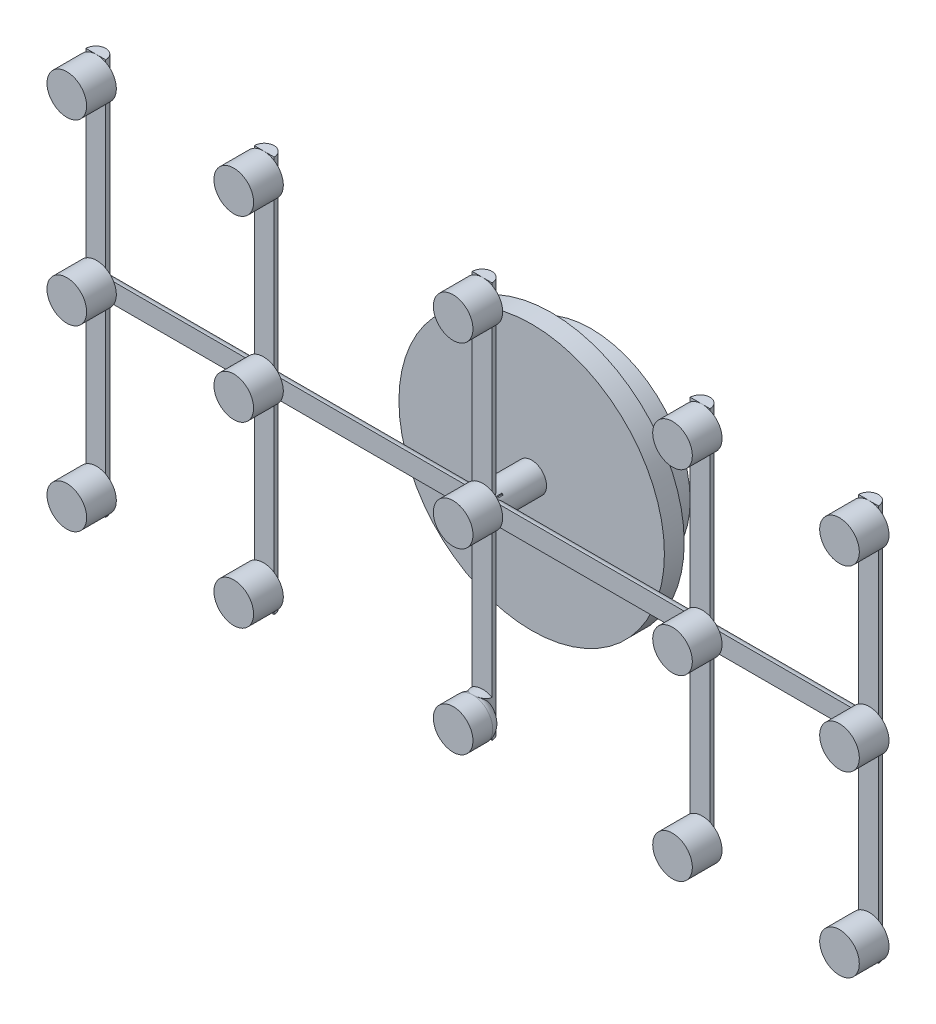
from build123d import *

# Parameters (mm, degrees)
SKIZZE2_R                       = 50
AUFSATZ_LINEAR_AUSTRAGEN1_DEPTH = 20
SKIZZE3_R                       = 67
AUFSATZ_LINEAR_AUSTRAGEN2_DEPTH = 10
SKIZZE5_R                       = 7.5
AUFSATZ_LINEAR_AUSTRAGEN3_DEPTH = 20
SKIZZE6_W                       = 400
SKIZZE6_H                       = 10
AUFSATZ_LINEAR_AUSTRAGEN4_DEPTH = 5
SKIZZE7_W                       = 10
SKIZZE7_H                       = 200
AUFSATZ_LINEAR_AUSTRAGEN5_DEPTH = 5
SKIZZE8_W                       = 10
SKIZZE8_H                       = 200
AUFSATZ_LINEAR_AUSTRAGEN6_DEPTH = 5
SKIZZE9_R                       = 10
AUFSATZ_LINEAR_AUSTRAGEN7_DEPTH = 15
VERRUNDUNG5_R                   = 5
VERRUNDUNG6_R                   = 5


with BuildPart() as part:
    # Skizze2 → Aufsatz-Linear austragen1 (new body)
    with BuildSketch(Plane.XY):
        Circle(SKIZZE2_R)
    extrude(amount=AUFSATZ_LINEAR_AUSTRAGEN1_DEPTH)

    # Skizze3 → Aufsatz-Linear austragen2 (add)
    with BuildSketch(Plane.XY.offset(20)):
        Circle(SKIZZE3_R)
    extrude(amount=AUFSATZ_LINEAR_AUSTRAGEN2_DEPTH)

    # Skizze5 → Aufsatz-Linear austragen3 (add)
    with BuildSketch(Plane.XY.offset(30)):
        Circle(SKIZZE5_R)
    extrude(amount=AUFSATZ_LINEAR_AUSTRAGEN3_DEPTH)

    # Skizze6 → Aufsatz-Linear austragen4 (add)
    with BuildSketch(Plane.XY.offset(50)):
        Rectangle(SKIZZE6_W, SKIZZE6_H)
    extrude(amount=AUFSATZ_LINEAR_AUSTRAGEN4_DEPTH)

    # Skizze7 → Aufsatz-Linear austragen5 (add)
    with BuildSketch(Plane.XY.offset(50)):
        Rectangle(SKIZZE7_W, SKIZZE7_H)
    extrude(amount=AUFSATZ_LINEAR_AUSTRAGEN5_DEPTH)

    # Skizze8 → Aufsatz-Linear austragen6 (add)
    with BuildSketch(Plane.XY.offset(50)):
        with Locations((-110, 0)):
            Rectangle(SKIZZE8_W, SKIZZE8_H)
        with Locations((110, 0)):
            Rectangle(SKIZZE8_W, SKIZZE8_H)
        with Locations((-195, 0)):
            Rectangle(SKIZZE8_W, SKIZZE8_H)
        with Locations((195, 0)):
            Rectangle(SKIZZE8_W, SKIZZE8_H)
    extrude(amount=AUFSATZ_LINEAR_AUSTRAGEN6_DEPTH)

    # Skizze9 → Aufsatz-Linear austragen7 (add)
    with BuildSketch(Plane.XY.offset(55)):
        with Locations(Location((-194.635853284, 90, 0), (0, 0, 237.560098087))):
            Circle(SKIZZE9_R)
        with Locations(Location((-194.635853284, 0, 0), (0, 0, 237.560098087))):
            Circle(SKIZZE9_R)
        with Locations(Location((-110.364146716, 0, 0), (0, 0, 180))):
            Circle(SKIZZE9_R)
        with Locations(Location((-110.364146716, 90, 0), (0, 0, 180))):
            Circle(SKIZZE9_R)
        with Locations(Location((0.364146716, 0, 0), (0, 0, 150))):
            Circle(SKIZZE9_R)
        with Locations(Location((0.364146716, 90, 0), (0, 0, 237.560098087))):
            Circle(SKIZZE9_R)
        with Locations(Location((111.092440149, 0, 0), (0, 0, 150))):
            Circle(SKIZZE9_R)
        with Locations(Location((111.092440149, 90, 0), (0, 0, 127.534860373))):
            Circle(SKIZZE9_R)
        with Locations(Location((195.364146716, 0, 0), (0, 0, 180))):
            Circle(SKIZZE9_R)
        with Locations(Location((195.364146716, 90, 0), (0, 0, 180))):
            Circle(SKIZZE9_R)
        with Locations(Location((195.364146716, -90, 0), (0, 0, 122.439901913))):
            Circle(SKIZZE9_R)
        with Locations(Location((111.092440149, -90, 0), (0, 0, 180))):
            Circle(SKIZZE9_R)
        with Locations(Location((0.364146716, -90, 0), (0, 0, 180))):
            Circle(SKIZZE9_R)
        with Locations(Location((-110.364146716, -90, 0), (0, 0, 117.618705292))):
            Circle(SKIZZE9_R)
        with Locations(Location((-194.635853284, -90, 0), (0, 0, 180))):
            Circle(SKIZZE9_R)
    extrude(amount=AUFSATZ_LINEAR_AUSTRAGEN7_DEPTH)

    # Verrundung5
    # the kernel refuses this fillet: 5 mm, written as the material it takes off along each edge
    with BuildSketch(Plane(origin=(-190, -112.5, 50), x_dir=(-1, 0, 0), z_dir=(0, 1, 0))) as verrundung5_piece_1_section:
        with BuildLine():
            CenterArc((VERRUNDUNG5_R, VERRUNDUNG5_R), VERRUNDUNG5_R, 180, 90)
            Line((0, VERRUNDUNG5_R), (0, 0))
            Line((0, 0), (VERRUNDUNG5_R, 0))
        make_face()
    verrundung5_piece_1 = extrude(amount=120, mode=Mode.PRIVATE)
    verrundung5_piece_1 = verrundung5_piece_1 - Plane(origin=(-190, 0, 55), x_dir=(0, 0, -1), z_dir=(1, 0, 0)) * Cylinder(5, 260, mode=Mode.PRIVATE)
    add(verrundung5_piece_1, mode=Mode.SUBTRACT)
    with BuildSketch(Plane(origin=(-200, -112.5, 50), x_dir=(1, 0, 0), z_dir=(0, 1, 0)), Plane(origin=(200, 112.5, 50), x_dir=(-1, 0, 0), z_dir=(0, -1, 0))) as verrundung5_piece_2:
        with BuildLine():
            CenterArc((VERRUNDUNG5_R, -VERRUNDUNG5_R), VERRUNDUNG5_R, 90, 90)
            Line((0, -VERRUNDUNG5_R), (0, 0))
            Line((0, 0), (VERRUNDUNG5_R, 0))
        make_face()
    extrude(amount=225, mode=Mode.SUBTRACT)
    with BuildSketch(Plane(origin=(190, -7.5, 50), x_dir=(1, 0, 0), z_dir=(0, 1, 0))) as verrundung5_piece_3_section:
        with BuildLine():
            CenterArc((VERRUNDUNG5_R, -VERRUNDUNG5_R), VERRUNDUNG5_R, 90, 90)
            Line((0, -VERRUNDUNG5_R), (0, 0))
            Line((0, 0), (VERRUNDUNG5_R, 0))
        make_face()
    verrundung5_piece_3 = extrude(amount=120, mode=Mode.PRIVATE)
    verrundung5_piece_3 = verrundung5_piece_3 - Plane(origin=(190, 0, 55), x_dir=(0, 0, -1), z_dir=(-1, 0, 0)) * Cylinder(5, 260, mode=Mode.PRIVATE)
    add(verrundung5_piece_3, mode=Mode.SUBTRACT)
    with BuildSketch(Plane(origin=(190, -112.5, 50), x_dir=(1, 0, 0), z_dir=(0, 1, 0))) as verrundung5_piece_4_section:
        with BuildLine():
            CenterArc((VERRUNDUNG5_R, -VERRUNDUNG5_R), VERRUNDUNG5_R, 90, 90)
            Line((0, -VERRUNDUNG5_R), (0, 0))
            Line((0, 0), (VERRUNDUNG5_R, 0))
        make_face()
    verrundung5_piece_4 = extrude(amount=120, mode=Mode.PRIVATE)
    verrundung5_piece_4 = verrundung5_piece_4 - Plane(origin=(190, 0, 55), x_dir=(0, 0, -1), z_dir=(1, 0, 0)) * Cylinder(5, 261, mode=Mode.PRIVATE)
    add(verrundung5_piece_4, mode=Mode.SUBTRACT)
    with BuildSketch(Plane(origin=(202.5, -5, 50), x_dir=(0, 1, 0), z_dir=(-1, 0, 0))) as verrundung5_piece_5_section:
        with BuildLine():
            CenterArc((VERRUNDUNG5_R, -VERRUNDUNG5_R), VERRUNDUNG5_R, 90, 90)
            Line((0, -VERRUNDUNG5_R), (0, 0))
            Line((0, 0), (VERRUNDUNG5_R, 0))
        make_face()
    verrundung5_piece_5 = extrude(amount=100, mode=Mode.PRIVATE)
    verrundung5_piece_5 = verrundung5_piece_5 - Plane(origin=(195, -5, 55), x_dir=(0, 0, -1), z_dir=(0, -1, 0)) * Cylinder(5, 220, mode=Mode.PRIVATE)
    verrundung5_piece_5 = verrundung5_piece_5 - Plane(origin=(110, -5, 55), x_dir=(0, 0, -1), z_dir=(0, 1, 0)) * Cylinder(5, 220, mode=Mode.PRIVATE)
    add(verrundung5_piece_5, mode=Mode.SUBTRACT)
    with BuildSketch(Plane(origin=(102.5, 5, 50), x_dir=(0, -1, 0), z_dir=(1, 0, 0))) as verrundung5_piece_6_section:
        with BuildLine():
            CenterArc((VERRUNDUNG5_R, -VERRUNDUNG5_R), VERRUNDUNG5_R, 90, 90)
            Line((0, -VERRUNDUNG5_R), (0, 0))
            Line((0, 0), (VERRUNDUNG5_R, 0))
        make_face()
    verrundung5_piece_6 = extrude(amount=100, mode=Mode.PRIVATE)
    verrundung5_piece_6 = verrundung5_piece_6 - Plane(origin=(110, 5, 55), x_dir=(0, 0, -1), z_dir=(0, 1, 0)) * Cylinder(5, 220, mode=Mode.PRIVATE)
    verrundung5_piece_6 = verrundung5_piece_6 - Plane(origin=(195, 5, 55), x_dir=(0, 0, -1), z_dir=(0, -1, 0)) * Cylinder(5, 220, mode=Mode.PRIVATE)
    add(verrundung5_piece_6, mode=Mode.SUBTRACT)
    with BuildSketch(Plane(origin=(115, 112.5, 50), x_dir=(-1, 0, 0), z_dir=(0, -1, 0))) as verrundung5_piece_7_section:
        with BuildLine():
            CenterArc((VERRUNDUNG5_R, -VERRUNDUNG5_R), VERRUNDUNG5_R, 90, 90)
            Line((0, -VERRUNDUNG5_R), (0, 0))
            Line((0, 0), (VERRUNDUNG5_R, 0))
        make_face()
    verrundung5_piece_7 = extrude(amount=120, mode=Mode.PRIVATE)
    verrundung5_piece_7 = verrundung5_piece_7 - Plane(origin=(115, 0, 55), x_dir=(0, 0, -1), z_dir=(-1, 0, 0)) * Cylinder(5, 260, mode=Mode.PRIVATE)
    add(verrundung5_piece_7, mode=Mode.SUBTRACT)
    with BuildSketch(Plane(origin=(105, -7.5, 50), x_dir=(1, 0, 0), z_dir=(0, 1, 0))) as verrundung5_piece_8_section:
        with BuildLine():
            CenterArc((VERRUNDUNG5_R, -VERRUNDUNG5_R), VERRUNDUNG5_R, 90, 90)
            Line((0, -VERRUNDUNG5_R), (0, 0))
            Line((0, 0), (VERRUNDUNG5_R, 0))
        make_face()
    verrundung5_piece_8 = extrude(amount=120, mode=Mode.PRIVATE)
    verrundung5_piece_8 = verrundung5_piece_8 - Plane(origin=(105, 0, 55), x_dir=(0, 0, -1), z_dir=(-1, 0, 0)) * Cylinder(5, 260, mode=Mode.PRIVATE)
    add(verrundung5_piece_8, mode=Mode.SUBTRACT)
    with BuildSketch(Plane(origin=(105, -112.5, 50), x_dir=(1, 0, 0), z_dir=(0, 1, 0))) as verrundung5_piece_9_section:
        with BuildLine():
            CenterArc((VERRUNDUNG5_R, -VERRUNDUNG5_R), VERRUNDUNG5_R, 90, 90)
            Line((0, -VERRUNDUNG5_R), (0, 0))
            Line((0, 0), (VERRUNDUNG5_R, 0))
        make_face()
    verrundung5_piece_9 = extrude(amount=120, mode=Mode.PRIVATE)
    verrundung5_piece_9 = verrundung5_piece_9 - Plane(origin=(105, 0, 55), x_dir=(0, 0, -1), z_dir=(1, 0, 0)) * Cylinder(5, 261, mode=Mode.PRIVATE)
    add(verrundung5_piece_9, mode=Mode.SUBTRACT)
    with BuildSketch(Plane(origin=(115, 7.5, 50), x_dir=(-1, 0, 0), z_dir=(0, -1, 0))) as verrundung5_piece_10_section:
        with BuildLine():
            CenterArc((VERRUNDUNG5_R, -VERRUNDUNG5_R), VERRUNDUNG5_R, 90, 90)
            Line((0, -VERRUNDUNG5_R), (0, 0))
            Line((0, 0), (VERRUNDUNG5_R, 0))
        make_face()
    verrundung5_piece_10 = extrude(amount=120, mode=Mode.PRIVATE)
    verrundung5_piece_10 = verrundung5_piece_10 - Plane(origin=(115, 0, 55), x_dir=(0, 0, -1), z_dir=(1, 0, 0)) * Cylinder(5, 261, mode=Mode.PRIVATE)
    add(verrundung5_piece_10, mode=Mode.SUBTRACT)
    with BuildSketch(Plane(origin=(117.5, -5, 50), x_dir=(0, 1, 0), z_dir=(-1, 0, 0))) as verrundung5_piece_11_section:
        with BuildLine():
            CenterArc((VERRUNDUNG5_R, -VERRUNDUNG5_R), VERRUNDUNG5_R, 90, 90)
            Line((0, -VERRUNDUNG5_R), (0, 0))
            Line((0, 0), (VERRUNDUNG5_R, 0))
        make_face()
    verrundung5_piece_11 = extrude(amount=124.409830056, mode=Mode.PRIVATE)
    verrundung5_piece_11 = verrundung5_piece_11 - Plane(origin=(0, 0, 50), x_dir=(1, 0, 0), z_dir=(0, 0, -1)) * Cylinder(7.5, 269, mode=Mode.PRIVATE)
    verrundung5_piece_11 = verrundung5_piece_11 - Plane(origin=(110, -5, 55), x_dir=(0, 0, -1), z_dir=(0, -1, 0)) * Cylinder(5, 269, mode=Mode.PRIVATE)
    add(verrundung5_piece_11, mode=Mode.SUBTRACT)
    with BuildSketch(Plane(origin=(-6.909830056, 5, 50), x_dir=(0, -1, 0), z_dir=(1, 0, 0))) as verrundung5_piece_12_section:
        with BuildLine():
            CenterArc((VERRUNDUNG5_R, -VERRUNDUNG5_R), VERRUNDUNG5_R, 90, 90)
            Line((0, -VERRUNDUNG5_R), (0, 0))
            Line((0, 0), (VERRUNDUNG5_R, 0))
        make_face()
    verrundung5_piece_12 = extrude(amount=124.409830056, mode=Mode.PRIVATE)
    verrundung5_piece_12 = verrundung5_piece_12 - Plane(origin=(0, 0, 50), x_dir=(1, 0, 0), z_dir=(0, 0, -1)) * Cylinder(7.5, 269, mode=Mode.PRIVATE)
    verrundung5_piece_12 = verrundung5_piece_12 - Plane(origin=(110, 5, 55), x_dir=(0, 0, -1), z_dir=(0, -1, 0)) * Cylinder(5, 269, mode=Mode.PRIVATE)
    add(verrundung5_piece_12, mode=Mode.SUBTRACT)
    with BuildSketch(Plane(origin=(-5, 112.5, 50), x_dir=(1, 0, 0), z_dir=(0, -1, 0))) as verrundung5_piece_13_section:
        with BuildLine():
            CenterArc((VERRUNDUNG5_R, VERRUNDUNG5_R), VERRUNDUNG5_R, 180, 90)
            Line((0, VERRUNDUNG5_R), (0, 0))
            Line((0, 0), (VERRUNDUNG5_R, 0))
        make_face()
    verrundung5_piece_13 = extrude(amount=119.409830056, mode=Mode.PRIVATE)
    verrundung5_piece_13 = verrundung5_piece_13 - Plane(origin=(0, 0, 50), x_dir=(1, 0, 0), z_dir=(0, 0, -1)) * Cylinder(7.5, 259, mode=Mode.PRIVATE)
    add(verrundung5_piece_13, mode=Mode.SUBTRACT)
    with BuildSketch(Plane(origin=(5, -6.909830056, 50), x_dir=(-1, 0, 0), z_dir=(0, 1, 0))) as verrundung5_piece_14_section:
        with BuildLine():
            CenterArc((VERRUNDUNG5_R, VERRUNDUNG5_R), VERRUNDUNG5_R, 180, 90)
            Line((0, VERRUNDUNG5_R), (0, 0))
            Line((0, 0), (VERRUNDUNG5_R, 0))
        make_face()
    verrundung5_piece_14 = extrude(amount=119.409830056, mode=Mode.PRIVATE)
    verrundung5_piece_14 = verrundung5_piece_14 - Plane(origin=(0, 0, 50), x_dir=(1, 0, 0), z_dir=(0, 0, -1)) * Cylinder(7.5, 259, mode=Mode.PRIVATE)
    add(verrundung5_piece_14, mode=Mode.SUBTRACT)
    with BuildSketch(Plane(origin=(-5, 6.909830056, 50), x_dir=(1, 0, 0), z_dir=(0, -1, 0))) as verrundung5_piece_15_section:
        with BuildLine():
            CenterArc((VERRUNDUNG5_R, VERRUNDUNG5_R), VERRUNDUNG5_R, 180, 90)
            Line((0, VERRUNDUNG5_R), (0, 0))
            Line((0, 0), (VERRUNDUNG5_R, 0))
        make_face()
    verrundung5_piece_15 = extrude(amount=119.409830056, mode=Mode.PRIVATE)
    verrundung5_piece_15 = verrundung5_piece_15 - Plane(origin=(0, 0, 50), x_dir=(1, 0, 0), z_dir=(0, 0, -1)) * Cylinder(7.5, 259, mode=Mode.PRIVATE)
    add(verrundung5_piece_15, mode=Mode.SUBTRACT)
    with BuildSketch(Plane(origin=(5, -112.5, 50), x_dir=(-1, 0, 0), z_dir=(0, 1, 0))) as verrundung5_piece_16_section:
        with BuildLine():
            CenterArc((VERRUNDUNG5_R, VERRUNDUNG5_R), VERRUNDUNG5_R, 180, 90)
            Line((0, VERRUNDUNG5_R), (0, 0))
            Line((0, 0), (VERRUNDUNG5_R, 0))
        make_face()
    verrundung5_piece_16 = extrude(amount=119.409830056, mode=Mode.PRIVATE)
    verrundung5_piece_16 = verrundung5_piece_16 - Plane(origin=(0, 0, 50), x_dir=(1, 0, 0), z_dir=(0, 0, -1)) * Cylinder(7.5, 259, mode=Mode.PRIVATE)
    add(verrundung5_piece_16, mode=Mode.SUBTRACT)
    with BuildSketch(Plane(origin=(-202.5, 5, 50), x_dir=(0, -1, 0), z_dir=(1, 0, 0))) as verrundung5_piece_17_section:
        with BuildLine():
            CenterArc((VERRUNDUNG5_R, -VERRUNDUNG5_R), VERRUNDUNG5_R, 90, 90)
            Line((0, -VERRUNDUNG5_R), (0, 0))
            Line((0, 0), (VERRUNDUNG5_R, 0))
        make_face()
    verrundung5_piece_17 = extrude(amount=100, mode=Mode.PRIVATE)
    verrundung5_piece_17 = verrundung5_piece_17 - Plane(origin=(-195, 5, 55), x_dir=(0, 0, -1), z_dir=(0, -1, 0)) * Cylinder(5, 220, mode=Mode.PRIVATE)
    verrundung5_piece_17 = verrundung5_piece_17 - Plane(origin=(-110, 5, 55), x_dir=(0, 0, -1), z_dir=(0, 1, 0)) * Cylinder(5, 220, mode=Mode.PRIVATE)
    add(verrundung5_piece_17, mode=Mode.SUBTRACT)
    with BuildSketch(Plane(origin=(-102.5, -5, 50), x_dir=(0, 1, 0), z_dir=(-1, 0, 0))) as verrundung5_piece_18_section:
        with BuildLine():
            CenterArc((VERRUNDUNG5_R, -VERRUNDUNG5_R), VERRUNDUNG5_R, 90, 90)
            Line((0, -VERRUNDUNG5_R), (0, 0))
            Line((0, 0), (VERRUNDUNG5_R, 0))
        make_face()
    verrundung5_piece_18 = extrude(amount=100, mode=Mode.PRIVATE)
    verrundung5_piece_18 = verrundung5_piece_18 - Plane(origin=(-110, -5, 55), x_dir=(0, 0, -1), z_dir=(0, 1, 0)) * Cylinder(5, 220, mode=Mode.PRIVATE)
    verrundung5_piece_18 = verrundung5_piece_18 - Plane(origin=(-195, -5, 55), x_dir=(0, 0, -1), z_dir=(0, -1, 0)) * Cylinder(5, 220, mode=Mode.PRIVATE)
    add(verrundung5_piece_18, mode=Mode.SUBTRACT)
    with BuildSketch(Plane(origin=(-117.5, 5, 50), x_dir=(0, -1, 0), z_dir=(1, 0, 0))) as verrundung5_piece_19_section:
        with BuildLine():
            CenterArc((VERRUNDUNG5_R, -VERRUNDUNG5_R), VERRUNDUNG5_R, 90, 90)
            Line((0, -VERRUNDUNG5_R), (0, 0))
            Line((0, 0), (VERRUNDUNG5_R, 0))
        make_face()
    verrundung5_piece_19 = extrude(amount=124.409830056, mode=Mode.PRIVATE)
    verrundung5_piece_19 = verrundung5_piece_19 - Plane(origin=(0, 0, 50), x_dir=(1, 0, 0), z_dir=(0, 0, -1)) * Cylinder(7.5, 269, mode=Mode.PRIVATE)
    verrundung5_piece_19 = verrundung5_piece_19 - Plane(origin=(-110, 5, 55), x_dir=(0, 0, -1), z_dir=(0, -1, 0)) * Cylinder(5, 269, mode=Mode.PRIVATE)
    add(verrundung5_piece_19, mode=Mode.SUBTRACT)
    with BuildSketch(Plane(origin=(6.909830056, -5, 50), x_dir=(0, 1, 0), z_dir=(-1, 0, 0))) as verrundung5_piece_20_section:
        with BuildLine():
            CenterArc((VERRUNDUNG5_R, -VERRUNDUNG5_R), VERRUNDUNG5_R, 90, 90)
            Line((0, -VERRUNDUNG5_R), (0, 0))
            Line((0, 0), (VERRUNDUNG5_R, 0))
        make_face()
    verrundung5_piece_20 = extrude(amount=124.409830056, mode=Mode.PRIVATE)
    verrundung5_piece_20 = verrundung5_piece_20 - Plane(origin=(0, 0, 50), x_dir=(1, 0, 0), z_dir=(0, 0, -1)) * Cylinder(7.5, 269, mode=Mode.PRIVATE)
    verrundung5_piece_20 = verrundung5_piece_20 - Plane(origin=(-110, -5, 55), x_dir=(0, 0, -1), z_dir=(0, -1, 0)) * Cylinder(5, 269, mode=Mode.PRIVATE)
    add(verrundung5_piece_20, mode=Mode.SUBTRACT)
    with BuildSketch(Plane(origin=(-105, -7.5, 50), x_dir=(-1, 0, 0), z_dir=(0, 1, 0))) as verrundung5_piece_21_section:
        with BuildLine():
            CenterArc((VERRUNDUNG5_R, VERRUNDUNG5_R), VERRUNDUNG5_R, 180, 90)
            Line((0, VERRUNDUNG5_R), (0, 0))
            Line((0, 0), (VERRUNDUNG5_R, 0))
        make_face()
    verrundung5_piece_21 = extrude(amount=120, mode=Mode.PRIVATE)
    verrundung5_piece_21 = verrundung5_piece_21 - Plane(origin=(-105, 0, 55), x_dir=(0, 0, -1), z_dir=(-1, 0, 0)) * Cylinder(5, 260, mode=Mode.PRIVATE)
    add(verrundung5_piece_21, mode=Mode.SUBTRACT)
    with BuildSketch(Plane(origin=(-115, 112.5, 50), x_dir=(1, 0, 0), z_dir=(0, -1, 0))) as verrundung5_piece_22_section:
        with BuildLine():
            CenterArc((VERRUNDUNG5_R, VERRUNDUNG5_R), VERRUNDUNG5_R, 180, 90)
            Line((0, VERRUNDUNG5_R), (0, 0))
            Line((0, 0), (VERRUNDUNG5_R, 0))
        make_face()
    verrundung5_piece_22 = extrude(amount=120, mode=Mode.PRIVATE)
    verrundung5_piece_22 = verrundung5_piece_22 - Plane(origin=(-115, 0, 55), x_dir=(0, 0, -1), z_dir=(-1, 0, 0)) * Cylinder(5, 260, mode=Mode.PRIVATE)
    add(verrundung5_piece_22, mode=Mode.SUBTRACT)
    with BuildSketch(Plane(origin=(-115, 7.5, 50), x_dir=(1, 0, 0), z_dir=(0, -1, 0))) as verrundung5_piece_23_section:
        with BuildLine():
            CenterArc((VERRUNDUNG5_R, VERRUNDUNG5_R), VERRUNDUNG5_R, 180, 90)
            Line((0, VERRUNDUNG5_R), (0, 0))
            Line((0, 0), (VERRUNDUNG5_R, 0))
        make_face()
    verrundung5_piece_23 = extrude(amount=120, mode=Mode.PRIVATE)
    verrundung5_piece_23 = verrundung5_piece_23 - Plane(origin=(-115, 0, 55), x_dir=(0, 0, -1), z_dir=(1, 0, 0)) * Cylinder(5, 260, mode=Mode.PRIVATE)
    add(verrundung5_piece_23, mode=Mode.SUBTRACT)
    with BuildSketch(Plane(origin=(-105, -112.5, 50), x_dir=(-1, 0, 0), z_dir=(0, 1, 0))) as verrundung5_piece_24_section:
        with BuildLine():
            CenterArc((VERRUNDUNG5_R, VERRUNDUNG5_R), VERRUNDUNG5_R, 180, 90)
            Line((0, VERRUNDUNG5_R), (0, 0))
            Line((0, 0), (VERRUNDUNG5_R, 0))
        make_face()
    verrundung5_piece_24 = extrude(amount=120, mode=Mode.PRIVATE)
    verrundung5_piece_24 = verrundung5_piece_24 - Plane(origin=(-105, 0, 55), x_dir=(0, 0, -1), z_dir=(1, 0, 0)) * Cylinder(5, 260, mode=Mode.PRIVATE)
    add(verrundung5_piece_24, mode=Mode.SUBTRACT)
    with BuildSketch(Plane(origin=(-190, -7.5, 50), x_dir=(-1, 0, 0), z_dir=(0, 1, 0))) as verrundung5_piece_25_section:
        with BuildLine():
            CenterArc((VERRUNDUNG5_R, VERRUNDUNG5_R), VERRUNDUNG5_R, 180, 90)
            Line((0, VERRUNDUNG5_R), (0, 0))
            Line((0, 0), (VERRUNDUNG5_R, 0))
        make_face()
    verrundung5_piece_25 = extrude(amount=120, mode=Mode.PRIVATE)
    verrundung5_piece_25 = verrundung5_piece_25 - Plane(origin=(-190, 0, 55), x_dir=(0, 0, -1), z_dir=(-1, 0, 0)) * Cylinder(5, 260, mode=Mode.PRIVATE)
    add(verrundung5_piece_25, mode=Mode.SUBTRACT)

    # Verrundung6
    # the kernel refuses this fillet: 5 mm, written as the material it takes off along each edge
    with BuildSketch(Plane(origin=(0.364146716, -90, 55), x_dir=(-0.6953651355943523, -0.7186566135504828, 0), z_dir=(-0.7186566135504828, 0.6953651355943523, 0))) as verrundung6_piece_1_section:
        with BuildLine():
            CenterArc((10 - VERRUNDUNG6_R, VERRUNDUNG6_R), VERRUNDUNG6_R, 270, 90)
            Line((10, VERRUNDUNG6_R), (10, 0))
            Line((10, 0), (10 - VERRUNDUNG6_R, 0))
        make_face()
    verrundung6_piece_1 = revolve(axis=Axis((0.364146716, -90, 55), (0, 0, 1)), revolution_arc=268.112641883, mode=Mode.PRIVATE)
    verrundung6_piece_1 = verrundung6_piece_1 - Plane(origin=(0, -90, 55), x_dir=(1, 0, 0), z_dir=(0, 1, 0)) * Cylinder(5, 41, mode=Mode.PRIVATE)
    add(verrundung6_piece_1, mode=Mode.SUBTRACT)
    with BuildSketch(Plane(origin=(0.364146716, -90, 55), x_dir=(-1, 0, 0), z_dir=(0, 1, 0))) as verrundung6_piece_2_section:
        with BuildLine():
            CenterArc((10 - VERRUNDUNG6_R, VERRUNDUNG6_R), VERRUNDUNG6_R, 270, 90)
            Line((10, VERRUNDUNG6_R), (10, 0))
            Line((10, 0), (10 - VERRUNDUNG6_R, 0))
        make_face()
    verrundung6_piece_2 = revolve(axis=Axis((0.364146716, -90, 55), (0, 0, 1)), revolution_arc=129.191588487, mode=Mode.PRIVATE)
    verrundung6_piece_2 = verrundung6_piece_2 - Plane(origin=(0, -90, 55), x_dir=(1, 0, 0), z_dir=(0, 1, 0)) * Cylinder(5, 41, mode=Mode.PRIVATE)
    add(verrundung6_piece_2, mode=Mode.SUBTRACT)
    with BuildSketch(Plane(origin=(0.364146716, -90, 55), x_dir=(0.6319155273456598, 0.7750372676842427, 0), z_dir=(0.7750372676842427, -0.6319155273456598, 0))) as verrundung6_piece_3_section:
        with BuildLine():
            CenterArc((10 - VERRUNDUNG6_R, VERRUNDUNG6_R), VERRUNDUNG6_R, 270, 90)
            Line((10, VERRUNDUNG6_R), (10, 0))
            Line((10, 0), (10 - VERRUNDUNG6_R, 0))
        make_face()
    verrundung6_piece_3 = revolve(axis=Axis((0.364146716, -90, 55), (0, 0, 1)), revolution_arc=129.191588487, mode=Mode.PRIVATE)
    verrundung6_piece_3 = verrundung6_piece_3 - Plane(origin=(0, -90, 55), x_dir=(1, 0, 0), z_dir=(0, 1, 0)) * Cylinder(5, 41, mode=Mode.PRIVATE)
    add(verrundung6_piece_3, mode=Mode.SUBTRACT)


solid = part.part
